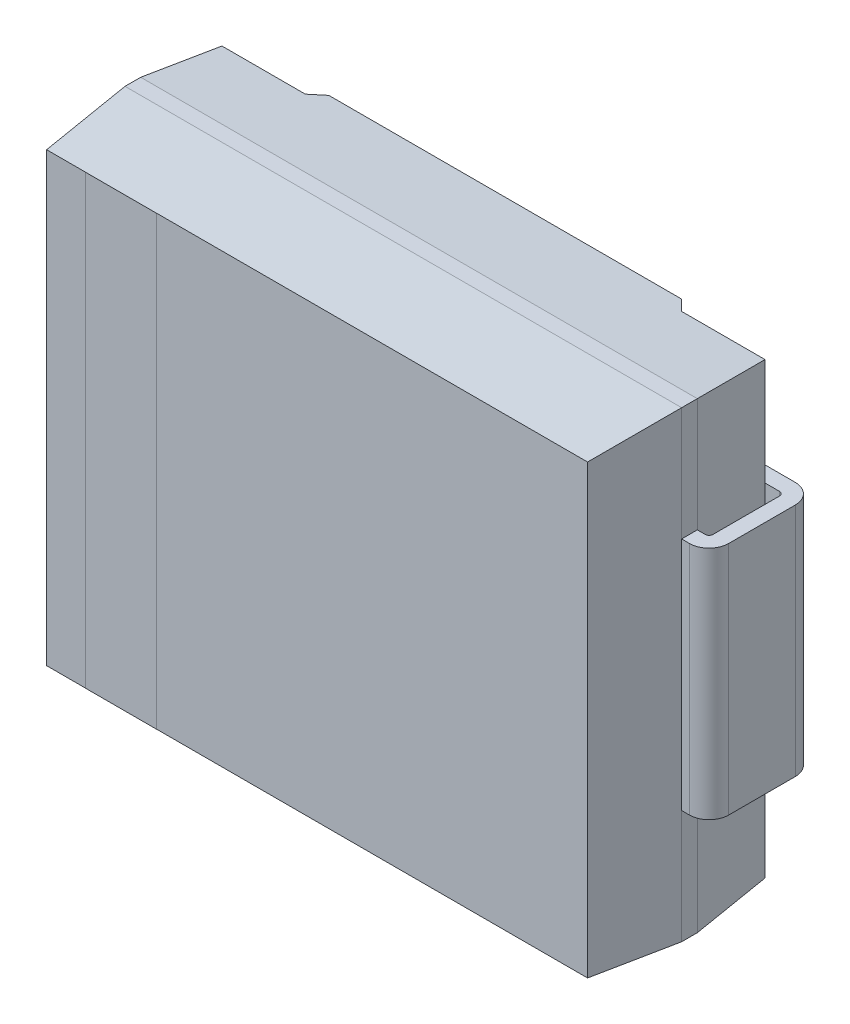
from build123d import *
from OCP.BRepFilletAPI import BRepFilletAPI_MakeChamfer

# Parameters (mm, degrees)
SZKIC1_W                    = 7.1
SZKIC1_H                    = 5.9
DODANIE_WYCI_GNI_CIE1_DEPTH = 2.4
SFAZOWANIE1_SIZE            = 1.1
SFAZOWANIE1_SIZE2           = 0.1
SFAZOWANIE2_SIZE            = 0.1
SFAZOWANIE2_SIZE2           = 1.1
SZKIC2_W                    = 0.9
SZKIC2_H                    = 5.7
DODANIE_WYCI_GNI_CIE2_DEPTH = 0.001
SZKIC3_W                    = 0.15
SZKIC3_H                    = 5.9
WYTNIJ_WYCI_GNI_CIE1_DEPTH  = 1.15
SFAZOWANIE3_SIZE            = 0.15
SZKIC4_W                    = 0.2
SZKIC4_H                    = 3
SFAZOWANIE3_OF_LUSTRO1_SIZE = 0.15


with BuildPart() as part:
    # Szkic1 → Dodanie-wyciągnięcie1 (new body)
    with BuildSketch(Plane.XY):
        Rectangle(SZKIC1_W, SZKIC1_H)
    extrude(amount=DODANIE_WYCI_GNI_CIE1_DEPTH)

    # Sfazowanie1: one chamfer whose edges measure the first distance from different faces: ONE call of the kernel's chamfer builder (chamfer() names one face for all edges)
    sfazowanie1_edges_1 = [part.edges().sort_by_distance(p)[0] for p in [
        (3.55, 0, 2.4),
    ]]
    sfazowanie1_side_1 = [part.faces().sort_by_distance(p)[0] for p in [
        (3.55, 0, 1.2),
    ]]
    sfazowanie1_edges_2 = [part.edges().sort_by_distance(p)[0] for p in [
        (0, 2.95, 2.4),
    ]]
    sfazowanie1_side_2 = [part.faces().sort_by_distance(p)[0] for p in [
        (0, 2.95, 1.2),
    ]]
    sfazowanie1_edges_3 = [part.edges().sort_by_distance(p)[0] for p in [
        (-3.55, 0, 2.4),
    ]]
    sfazowanie1_side_3 = [part.faces().sort_by_distance(p)[0] for p in [
        (-3.55, 0, 1.2),
    ]]
    sfazowanie1_edges_4 = [part.edges().sort_by_distance(p)[0] for p in [
        (0, -2.95, 2.4),
    ]]
    sfazowanie1_side_4 = [part.faces().sort_by_distance(p)[0] for p in [
        (0, -2.95, 1.2),
    ]]
    sfazowanie1 = BRepFilletAPI_MakeChamfer(part.part.solid().wrapped)
    for e in sfazowanie1_edges_1:
        sfazowanie1.Add(SFAZOWANIE1_SIZE, SFAZOWANIE1_SIZE2, e.wrapped, sfazowanie1_side_1[0].wrapped)  # the first distance lies on this face
    for e in sfazowanie1_edges_2:
        sfazowanie1.Add(SFAZOWANIE1_SIZE, SFAZOWANIE1_SIZE2, e.wrapped, sfazowanie1_side_2[0].wrapped)  # the first distance lies on this face
    for e in sfazowanie1_edges_3:
        sfazowanie1.Add(SFAZOWANIE1_SIZE, SFAZOWANIE1_SIZE2, e.wrapped, sfazowanie1_side_3[0].wrapped)  # the first distance lies on this face
    for e in sfazowanie1_edges_4:
        sfazowanie1.Add(SFAZOWANIE1_SIZE, SFAZOWANIE1_SIZE2, e.wrapped, sfazowanie1_side_4[0].wrapped)  # the first distance lies on this face
    add(Compound.cast(sfazowanie1.Shape()), mode=Mode.REPLACE)

    # Sfazowanie2
    sfazowanie2_edges = [part.edges().sort_by_distance(p)[0] for p in [
        (0, 2.95, 0),
        (3.55, 0, 0),
        (0, -2.95, 0),
        (-3.55, 0, 0),
    ]]
    sfazowanie2_side = [part.faces().sort_by_distance(p)[0] for p in [
        (0, 0, 0),
    ]]
    chamfer(sfazowanie2_edges, length=SFAZOWANIE2_SIZE, length2=SFAZOWANIE2_SIZE2, reference=sfazowanie2_side[0])

    # Szkic2 → Dodanie-wyciągnięcie2 (add)
    with BuildSketch(Plane.XY.offset(2.4)):
        with Locations((-2.5, 0)):
            Rectangle(SZKIC2_W, SZKIC2_H)
    extrude(amount=DODANIE_WYCI_GNI_CIE2_DEPTH)

    # Szkic3 → Wytnij-wyciągnięcie1 (cut)
    with BuildSketch(Plane.ZY.offset(3.55)):
        with Locations((0.075, 0)):
            Rectangle(SZKIC3_W, SZKIC3_H)
    wytnij_wyci_gni_cie1 = extrude(amount=-WYTNIJ_WYCI_GNI_CIE1_DEPTH, mode=Mode.SUBTRACT)

    # Sfazowanie3
    sfazowanie3_edges = [part.edges().sort_by_distance(p)[0] for p in [
        (-2.4, 0, 0),
    ]]
    chamfer(sfazowanie3_edges, length=SFAZOWANIE3_SIZE - 0.0001)  # a hair under: the kernel refuses the full size

    # Wyciągnięcie po ścieżce1: sweep along a path in Szkic5
    with BuildLine(Plane(origin=(0, 0, 0), x_dir=(1, 0, 0), z_dir=(0, 1, 0))) as wyci_gni_cie_po_cie_ce1_path:
        Line((-3.55, -1.3), (-3.65, -1.3))
        ThreePointArc((-3.65, -1.3), (-3.826776695, -1.226776695), (-3.9, -1.05))
        Line((-3.9, -1.05), (-3.9, -0.2))
        ThreePointArc((-3.9, -0.2), (-3.826776695, -0.023223305), (-3.65, 0.05))
        Line((-3.65, 0.05), (-2.7, 0.05))
    # Szkic4 → Wyciągnięcie po ścieżce1 (sweep)
    with BuildSketch(Plane.ZY.offset(3.55)):
        with Locations((1.2, 0)):
            Rectangle(SZKIC4_W, SZKIC4_H)
    wyci_gni_cie_po_cie_ce1 = sweep(path=wyci_gni_cie_po_cie_ce1_path.line)

    # Lustro1: Wytnij-wyciągnięcie1, Wyciągnięcie po ścieżce1 across plane
    add(wytnij_wyci_gni_cie1.mirror(Plane(origin=(0, 0, 0), x_dir=(0, 0, 1), z_dir=(1, 0, 0))), mode=Mode.SUBTRACT)
    add(wyci_gni_cie_po_cie_ce1.mirror(Plane(origin=(0, 0, 0), x_dir=(0, 0, 1), z_dir=(1, 0, 0))))

    # Sfazowanie3 of Lustro1
    sfazowanie3_of_lustro1_edges = [part.edges().sort_by_distance(p)[0] for p in [
        (2.4, 0, 0),
    ]]
    chamfer(sfazowanie3_of_lustro1_edges, length=SFAZOWANIE3_OF_LUSTRO1_SIZE - 0.0001)  # a hair under: the kernel refuses the full size


solid = part.part
